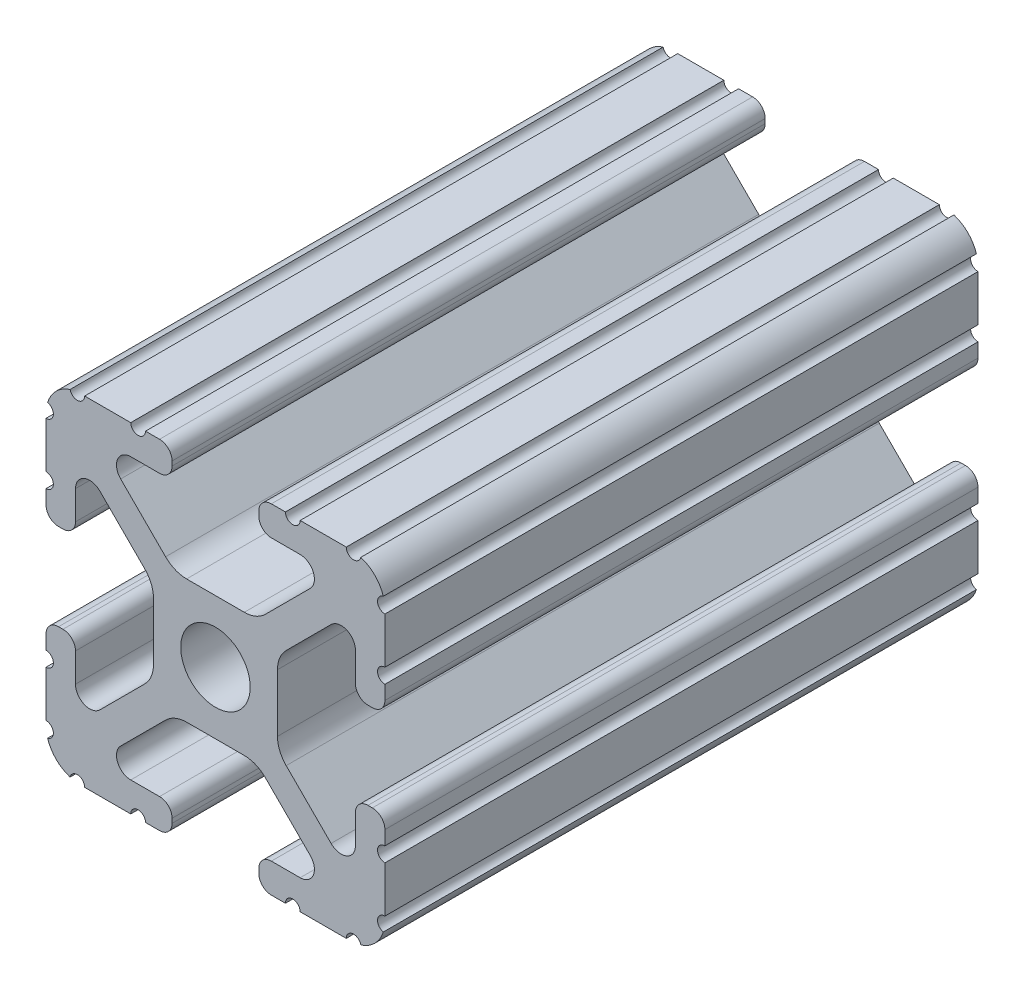
from build123d import *

# Parameters (mm, degrees)
BOSS_EXTRUDE1_DEPTH     = 22.225
CUT_EXTRUDE1_DEPTH      = 29.575
CUT_EXTRUDE1_DEPTH_BACK = 29.575
SKETCH5_R               = 0.55245
CUT_EXTRUDE2_DEPTH      = 29.575
CUT_EXTRUDE2_DEPTH_BACK = 29.575
SKETCH6_R               = 2.555


with BuildPart() as part:
    # Sketch4 → Boss-Extrude1 (new, symmetric)
    with BuildSketch(Plane.XY):
        with BuildLine():
            Line((4.190365, -12.7), (10.11729625, -12.7))
            ThreePointArc((10.11729625, -12.7), (11.943543585, -11.943543585), (12.7, -10.11729625))
            Line((12.7, -10.11729625), (12.7, -4.190365))
            ThreePointArc((12.7, -4.190365), (12.42492494, -3.52627506), (11.760835, -3.2512))
            Line((11.760835, -3.2512), (11.429365, -3.2512))
            ThreePointArc((11.429365, -3.2512), (10.76527506, -3.52627506), (10.4902, -4.190365))
            Line((10.4902, -4.190365), (10.4902, -6.348478019))
            ThreePointArc((10.4902, -6.348478019), (9.830707141, -7.335478831), (8.666460301, -7.103895736))
            Line((8.666460301, -7.103895736), (5.299899128, -3.737334563))
            ThreePointArc((5.299899128, -3.737334563), (4.817571085, -3.015479634), (4.6482, -2.16399369))
            Line((4.6482, -2.16399369), (4.6482, 0))
            Line((4.6482, 0), (2.6035, 0))
            ThreePointArc((2.6035, 0), (1.840952505, -1.840952505), (0, -2.6035))
            Line((0, -2.6035), (0, -4.6482))
            Line((0, -4.6482), (2.16399369, -4.6482))
            ThreePointArc((2.16399369, -4.6482), (3.015479634, -4.817571085), (3.737334563, -5.299899128))
            Line((3.737334563, -5.299899128), (7.103895736, -8.666460301))
            ThreePointArc((7.103895736, -8.666460301), (7.335478831, -9.830707141), (6.348478019, -10.4902))
            Line((6.348478019, -10.4902), (4.190365, -10.4902))
            ThreePointArc((4.190365, -10.4902), (3.52627506, -10.76527506), (3.2512, -11.429365))
            Line((3.2512, -11.429365), (3.2512, -11.760835))
            ThreePointArc((3.2512, -11.760835), (3.52627506, -12.42492494), (4.190365, -12.7))
        make_face()
    extrude(amount=BOSS_EXTRUDE1_DEPTH, both=True)

    # Sketch5 → Cut-Extrude1 (cut, two sides: drawn at the far end of the back side and taken through both)
    with BuildSketch(Plane.XY.offset(-CUT_EXTRUDE1_DEPTH_BACK)):
        with Locations((10.356153152, -12.7)):
            Circle(SKETCH5_R)
        with Locations((5.796028019, -12.7)):
            Circle(SKETCH5_R)
        with Locations((12.7, -10.356153152)):
            Circle(SKETCH5_R)
        with Locations((12.7, -5.796028019)):
            Circle(SKETCH5_R)
    extrude(amount=CUT_EXTRUDE1_DEPTH + CUT_EXTRUDE1_DEPTH_BACK, mode=Mode.SUBTRACT)

    # Mirror1: part across plane


with BuildPart() as part_1:
    add(part.part)
    add(part.part.mirror(Plane(origin=(0, 0, 0), x_dir=(0, 0, 1), z_dir=(1, 0, 0))))

    # Mirror2: part across plane


with BuildPart() as part_2:
    add(part_1.part)
    add(part_1.part.mirror(Plane.ZX))

    # Sketch6 → Cut-Extrude2 (cut, two sides: drawn at the far end of the back side and taken through both)
    with BuildSketch(Plane(origin=(0, 0, 0), x_dir=(1, 0, 0), z_dir=(0, 1, 0)).offset(-CUT_EXTRUDE2_DEPTH_BACK)):
        with Locations((0, -9.525)):
            Circle(SKETCH6_R)
        with Locations((0, 9.525)):
            Circle(SKETCH6_R)
    extrude(amount=CUT_EXTRUDE2_DEPTH + CUT_EXTRUDE2_DEPTH_BACK, mode=Mode.SUBTRACT)


solid = part_2.part
